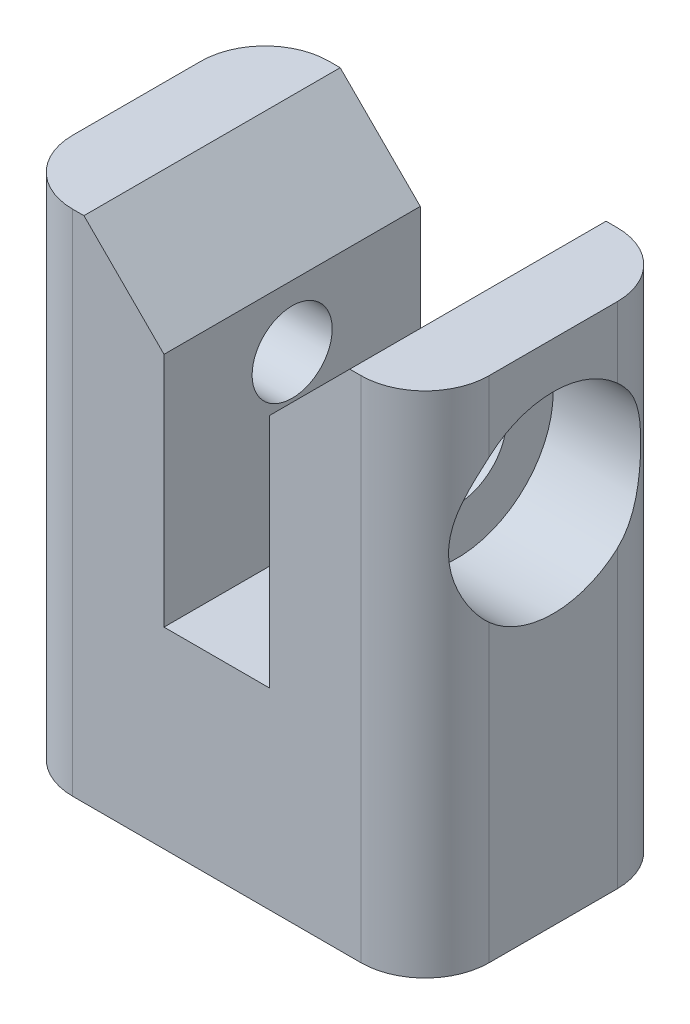
from build123d import *

# Parameters (mm, degrees)
BOSS_EXTRUDE1_DEPTH            = 4
M3X0_5_TAPPED_HOLE1_D          = 2.5
CBORE_FOR_M3_SHCS1_D           = 3.1
CBORE_FOR_M3_SHCS1_DEPTH       = 4.85
CBORE_FOR_M3_SHCS1_CBORE_D     = 6
CBORE_FOR_M3_SHCS1_CBORE_DEPTH = 3
CBORE_FOR_M3_SHCS1_TIP         = 0.931333959
M3_TAPPED_HOLE1_D              = 2.5
M3_TAPPED_HOLE1_DEPTH          = 5
M3_TAPPED_HOLE1_TIP            = 0.751075774
CHAMFER1_SIZE                  = 2.5
FILLET1_R                      = 2


with BuildPart() as part:
    # Sketch1 → Boss-Extrude1 (new, symmetric)
    with BuildSketch(Plane.XY):
        Polygon((-6.5, 0), (6.5, 0), (6.5, 15.875), (1.65, 15.875), (1.65, 6), (-1.65, 6), (-1.65, 15.875), (-6.5, 15.875), align=None)
    extrude(amount=BOSS_EXTRUDE1_DEPTH, both=True)

    # M3x0.5 Tapped Hole1 (through all)
    with Locations(Plane(origin=(6.5, 0, 0), x_dir=(0, 0, -1), z_dir=(1, 0, 0))):
        with Locations((0, 11.4375)):
            Hole(M3X0_5_TAPPED_HOLE1_D / 2)

    # CBORE for M3 SHCS1
    with Locations(Plane(origin=(6.5, 0, 0), x_dir=(0, 0, -1), z_dir=(1, 0, 0))):
        with Locations((0, 11.4375)):
            CounterBoreHole(CBORE_FOR_M3_SHCS1_D / 2, CBORE_FOR_M3_SHCS1_CBORE_D / 2, CBORE_FOR_M3_SHCS1_CBORE_DEPTH, depth=CBORE_FOR_M3_SHCS1_DEPTH)
            with Locations((0, 0, -(CBORE_FOR_M3_SHCS1_DEPTH + CBORE_FOR_M3_SHCS1_TIP / 2))):  # 118° drill point
                Cone(0, CBORE_FOR_M3_SHCS1_D / 2, CBORE_FOR_M3_SHCS1_TIP, mode=Mode.SUBTRACT)

    # M3 Tapped Hole1
    with Locations(Plane(origin=(0, 0, 0), x_dir=(-1, 0, 0), z_dir=(0, -1, 0))):
        with Locations((0, 0)):
            Hole(M3_TAPPED_HOLE1_D / 2, depth=M3_TAPPED_HOLE1_DEPTH)
            with Locations((0, 0, -(M3_TAPPED_HOLE1_DEPTH + M3_TAPPED_HOLE1_TIP / 2))):  # 118° drill point
                Cone(0, M3_TAPPED_HOLE1_D / 2, M3_TAPPED_HOLE1_TIP, mode=Mode.SUBTRACT)

    # Chamfer1
    chamfer1_edges = [part.edges().sort_by_distance(p)[0] for p in [
        (-1.65, 15.875, 0),
        (1.65, 15.875, 0),
    ]]
    chamfer(chamfer1_edges, length=CHAMFER1_SIZE)

    # Fillet1
    # the kernel refuses this fillet: 2 mm, written as the material it takes off along each edge
    with BuildSketch(Plane(origin=(6.5, -5, -4), x_dir=(-1, 0, 0), z_dir=(0, 1, 0)), Plane(origin=(-6.5, 20.875, 4), x_dir=(0, 0, -1), z_dir=(0, -1, 0)), Plane(origin=(6.5, -5, 4), x_dir=(0, 0, -1), z_dir=(0, 1, 0)), Plane(origin=(-6.5, 20.875, -4), x_dir=(1, 0, 0), z_dir=(0, -1, 0))) as fillet1_piece_1:
        with BuildLine():
            CenterArc((FILLET1_R, FILLET1_R), FILLET1_R, 180, 90)
            Line((0, FILLET1_R), (0, 0))
            Line((0, 0), (FILLET1_R, 0))
        make_face()
    extrude(amount=25.875, mode=Mode.SUBTRACT)


solid = part.part
